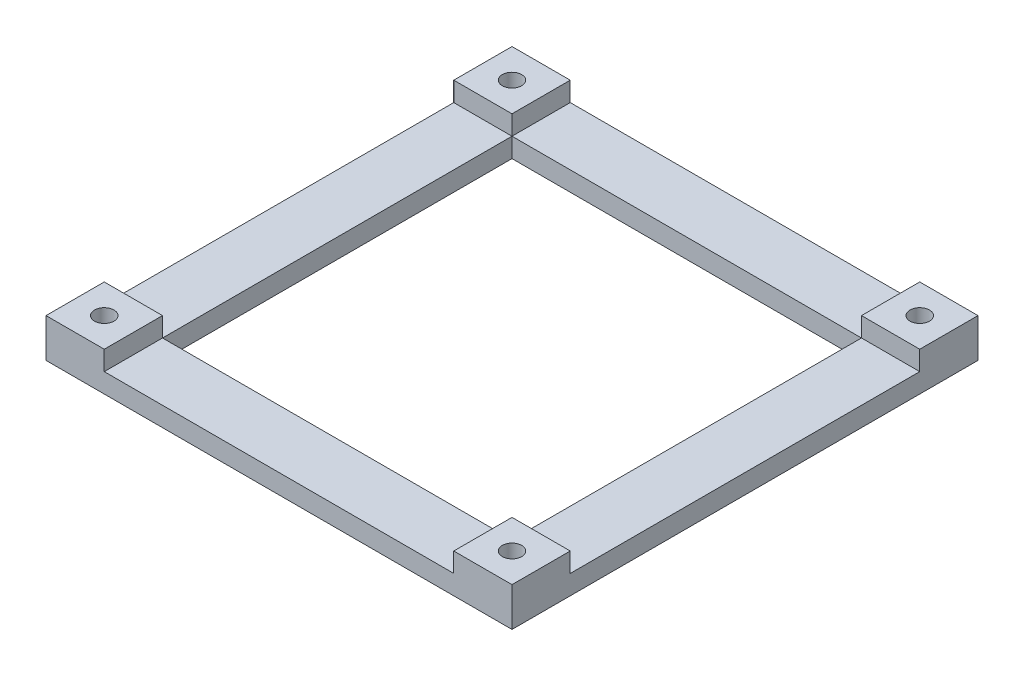
from build123d import *

# Parameters (mm, degrees)
SKETCH2_W           = 120
SKETCH2_H           = 120
SKETCH2_W_2         = 90
SKETCH2_H_2         = 90
BOSS_EXTRUDE1_DEPTH = 5
SKETCH3_W           = 15
SKETCH3_H           = 15
BOSS_EXTRUDE2_DEPTH = 5
SKETCH4_R           = 2.5
CUT_EXTRUDE1_DEPTH  = 86.440037453


with BuildPart() as part:
    # Sketch2 → Boss-Extrude1 (new body)
    with BuildSketch(Plane(origin=(0, 0, 0), x_dir=(1, 0, 0), z_dir=(0, 1, 0))):
        Rectangle(SKETCH2_W, SKETCH2_H)
        Rectangle(SKETCH2_W_2, SKETCH2_H_2, mode=Mode.SUBTRACT)
    extrude(amount=BOSS_EXTRUDE1_DEPTH)

    # Sketch3 → Boss-Extrude2 (add)
    with BuildSketch(Plane(origin=(0, 5, 0), x_dir=(1, 0, 0), z_dir=(0, 1, 0))):
        with Locations((52.5, 52.5)):
            Rectangle(SKETCH3_W, SKETCH3_H)
        with Locations((-52.5, 52.5)):
            Rectangle(SKETCH3_W, SKETCH3_H)
        with Locations((52.5, -52.5)):
            Rectangle(SKETCH3_W, SKETCH3_H)
        with Locations((-52.5, -52.5)):
            Rectangle(SKETCH3_W, SKETCH3_H)
    extrude(amount=BOSS_EXTRUDE2_DEPTH)

    # Sketch4 → Cut-Extrude1 (cut, through all)
    with BuildSketch(Plane(origin=(0, 10, 0), x_dir=(1, 0, 0), z_dir=(0, 1, 0))):
        with Locations((-52.5, -52.5)):
            Circle(SKETCH4_R)
        with Locations((-52.5, 52.5)):
            Circle(SKETCH4_R)
        with Locations((52.5, 52.5)):
            Circle(SKETCH4_R)
        with Locations((52.5, -52.5)):
            Circle(SKETCH4_R)
    extrude(amount=-CUT_EXTRUDE1_DEPTH, mode=Mode.SUBTRACT)


solid = part.part
